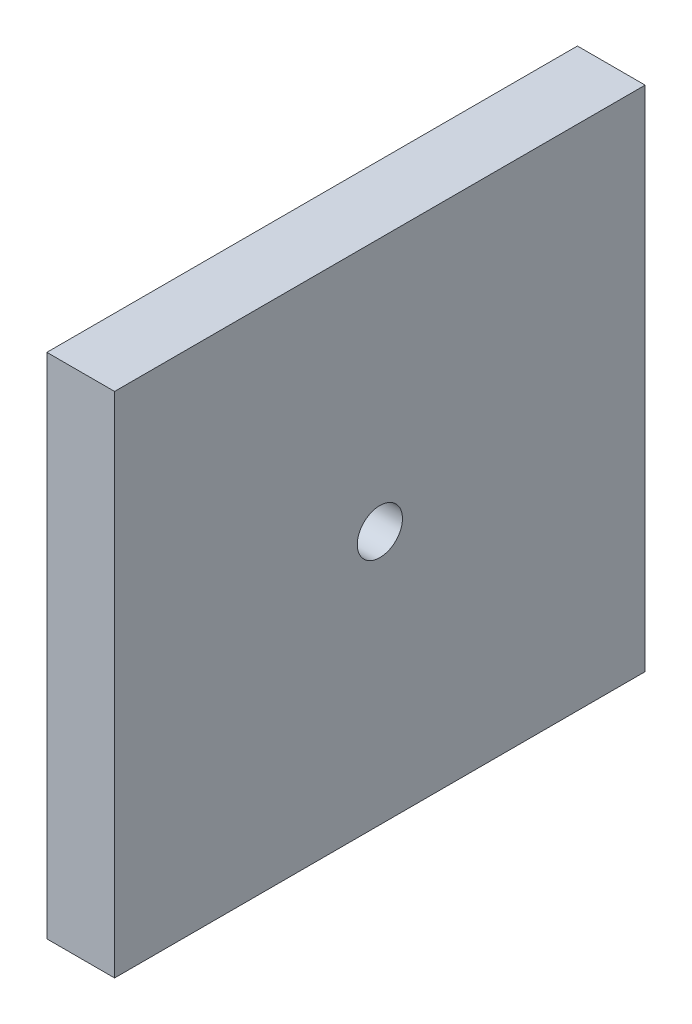
from build123d import *

# Parameters (mm, degrees)
SKETCH1_W           = 94
SKETCH1_H           = 90
BOSS_EXTRUDE1_DEPTH = 12
SKETCH2_R           = 4
CUT_EXTRUDE1_DEPTH  = 67.166456759


with BuildPart() as part:
    # Sketch1 → Boss-Extrude1 (new body)
    with BuildSketch(Plane(origin=(0, 0, 0), x_dir=(0, 0, -1), z_dir=(1, 0, 0))):
        Rectangle(SKETCH1_W, SKETCH1_H)
    extrude(amount=BOSS_EXTRUDE1_DEPTH)

    # Sketch2 → Cut-Extrude1 (cut, through all)
    with BuildSketch(Plane(origin=(12, 0, 0), x_dir=(0, 0, -1), z_dir=(1, 0, 0))):
        Circle(SKETCH2_R)
    extrude(amount=-CUT_EXTRUDE1_DEPTH, mode=Mode.SUBTRACT)


solid = part.part
